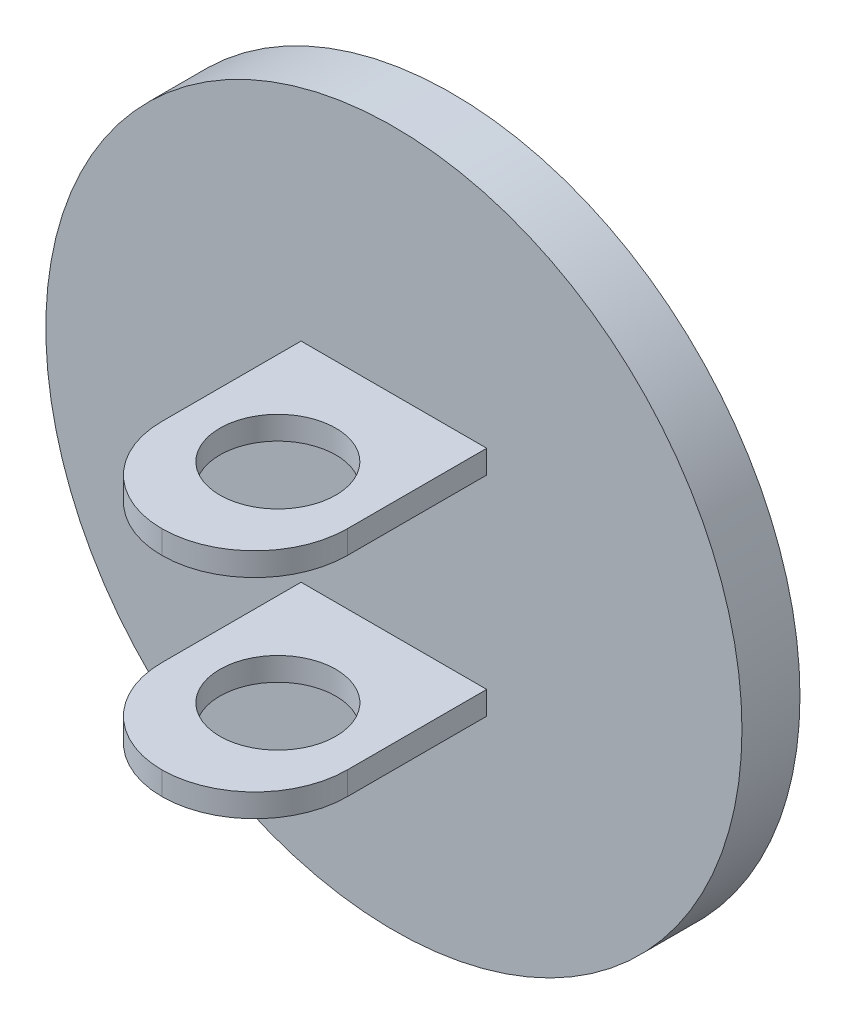
from build123d import *

# Parameters (mm, degrees)
SKETCH1_R           = 25
BOSS_EXTRUDE1_DEPTH = 35
SKETCH2_R           = 150
BOSS_EXTRUDE2_DEPTH = 25
SKETCH3_W           = 80
SKETCH3_H           = 10
BOSS_EXTRUDE3_DEPTH = 100
SKETCH4_R           = 25
CUT_EXTRUDE1_DEPTH  = 297.816441593
FILLET1_R           = 40


with BuildPart() as part:
    # Sketch1 → Boss-Extrude1 (new body)
    with BuildSketch(Plane.XY):
        Circle(SKETCH1_R)
    extrude(amount=BOSS_EXTRUDE1_DEPTH)

    # Sketch2 → Boss-Extrude2 (add)
    with BuildSketch(Plane.XY.offset(35)):
        Circle(SKETCH2_R)
    extrude(amount=BOSS_EXTRUDE2_DEPTH)

    # Sketch3 → Boss-Extrude3 (add)
    with BuildSketch(Plane.XY.offset(60)):
        with Locations((0, -45)):
            Rectangle(SKETCH3_W, SKETCH3_H)
        with Locations((0, 45)):
            Rectangle(SKETCH3_W, SKETCH3_H)
    extrude(amount=BOSS_EXTRUDE3_DEPTH)

    # Sketch4 → Cut-Extrude1 (cut, through all)
    with BuildSketch(Plane.XZ.offset(50)):
        with Locations(Location((0, 110, 0), (0, 0, 90))):
            Circle(SKETCH4_R)
    extrude(amount=-CUT_EXTRUDE1_DEPTH, mode=Mode.SUBTRACT)

    # Fillet1
    fillet1_edges = [part.edges().sort_by_distance(p)[0] for p in [
        (40, -45, 160),
        (40, 45, 160),
        (-40, 45, 160),
        (-40, -45, 160),
    ]]
    fillet(fillet1_edges, radius=FILLET1_R - 0.0001)  # a hair under: the kernel refuses the full size


solid = part.part
